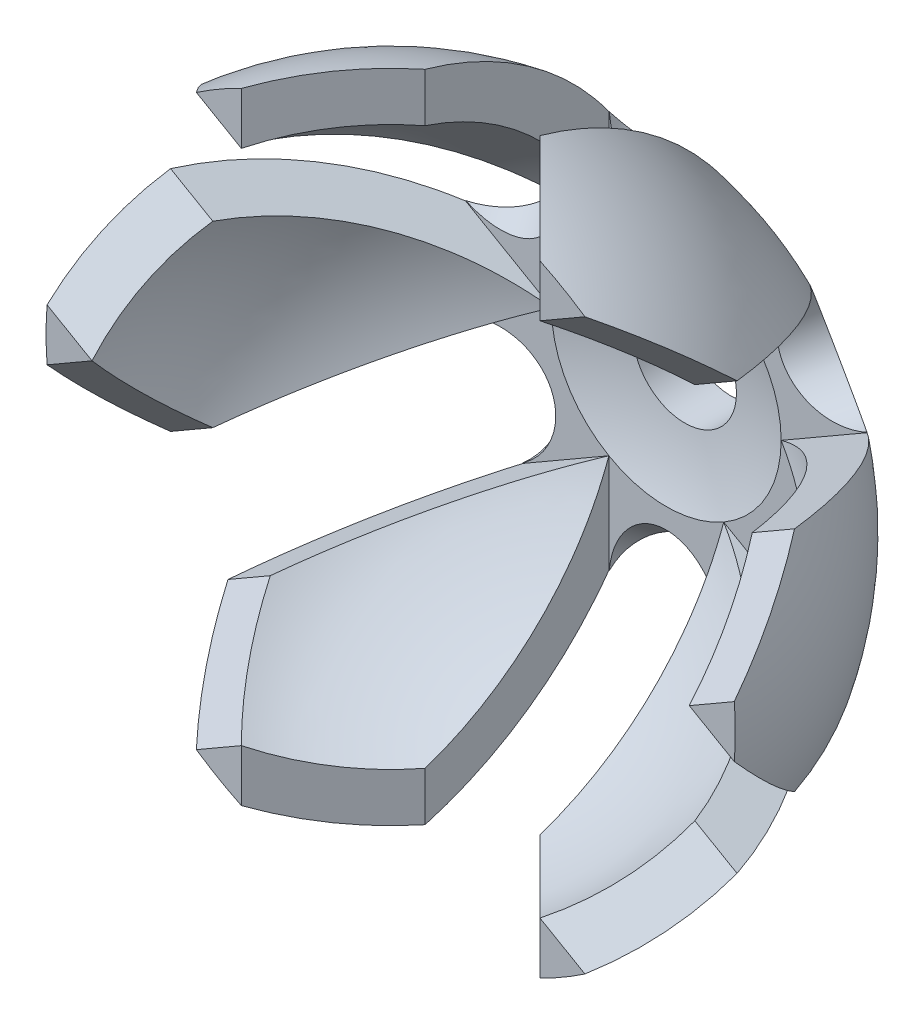
from build123d import *
from build123d.topology import SkipClean

# Parameters (mm, degrees)
CUT_EXTRUDE1_DEPTH      = 26.980762114
CUT_EXTRUDE1_DEPTH_BACK = 26.980762114
SKETCH2_R               = 2.25
CUT_EXTRUDE2_DEPTH      = 26.88315089
CUT_EXTRUDE3_DEPTH      = 31.577337854
CIRPATTERN1_COUNT       = 6
CHAMFER1_SIZE           = 4


with BuildPart() as part:
    # Sketch1 → Revolve1 (revolve)
    with BuildSketch(Plane(origin=(0, 0, 0), x_dir=(1, 0, 0), z_dir=(0, 1, 0))):
        with BuildLine():
            Line((0, 15), (0, 13))
            ThreePointArc((0, 13), (9.192388155, 9.192388155), (13, 0))
            Line((13, 0), (15, 0))
            ThreePointArc((15, 0), (10.606601718, 10.606601718), (0, 15))
        make_face()
    revolve(axis=Axis((0, 0, -15), (0, 0, 1)))

    # Sketch2 → Cut-Extrude1 (cut, two sides: drawn at the far end of the back side and taken through both)
    with BuildSketch(Plane.XY.offset(-CUT_EXTRUDE1_DEPTH_BACK)):
        Circle(SKETCH2_R)
    extrude(amount=CUT_EXTRUDE1_DEPTH + CUT_EXTRUDE1_DEPTH_BACK, mode=Mode.SUBTRACT)

    # Sketch3 → Cut-Extrude2 (cut, symmetric)
    with BuildSketch(Plane(origin=(0, 0, 0), x_dir=(1, 0, 0), z_dir=(0, 1, 0))):
        Polygon((-2.5, -55.877554425), (-2.5, 0), (-2.5, 12), (2.5, 12), (2.5, 0), (2.5, -55.877554425), (2.5, -167.632663274), (-2.5, -167.632663274), align=None)
    cut_extrude2 = extrude(amount=CUT_EXTRUDE2_DEPTH, both=True, mode=Mode.SUBTRACT)

    # Sketch5 → Cut-Extrude3 (cut, symmetric)
    with BuildSketch(Plane(origin=(0, 9, -12), x_dir=(-1, 0, 0), z_dir=(0, 0.6000000000000006, -0.7999999999999996))):
        with BuildLine():
            Line((-2.5, 0), (2.5, 0))
            ThreePointArc((2.5, 0), (0, -2.5), (-2.5, 0))
        make_face()
    cut_extrude3 = extrude(amount=CUT_EXTRUDE3_DEPTH, both=True, mode=Mode.SUBTRACT)

    # CirPattern1: Cut-Extrude2, Cut-Extrude3 ×6 about axis
    with SkipClean():  # the faces are left unmerged after this step: merging them gives an invalid solid
        cirpattern1_axis = Axis((0, 0, -15), (0, 0, 1))
        add([cut_extrude2.rotate(cirpattern1_axis, i * 360 / CIRPATTERN1_COUNT) for i in range(1, CIRPATTERN1_COUNT)], mode=Mode.SUBTRACT)
        add([cut_extrude3.rotate(cirpattern1_axis, i * 360 / CIRPATTERN1_COUNT) for i in range(1, CIRPATTERN1_COUNT)], mode=Mode.SUBTRACT)

    # Chamfer1
    chamfer1_edges = [part.edges().sort_by_distance(p)[0] for p in [
        (-2.5, -13.77377514, 0),
        (-2.5, 13.77377514, 0),
        (2.5, -13.77377514, 0),
        (2.5, 13.77377514, 0),
        (-13.178439177, 4.721824061, 0),
        (10.678439177, -9.051951079, 0),
        (13.178439177, -4.721824061, 0),
        (-10.678439177, 9.051951079, 0),
        (-10.678439177, -9.051951079, 0),
        (13.178439177, 4.721824061, 0),
        (10.678439177, 9.051951079, 0),
        (-13.178439177, -4.721824061, 0),
    ]]
    chamfer(chamfer1_edges, length=CHAMFER1_SIZE - 0.0001)  # a hair under: the kernel refuses the full size


solid = part.part
